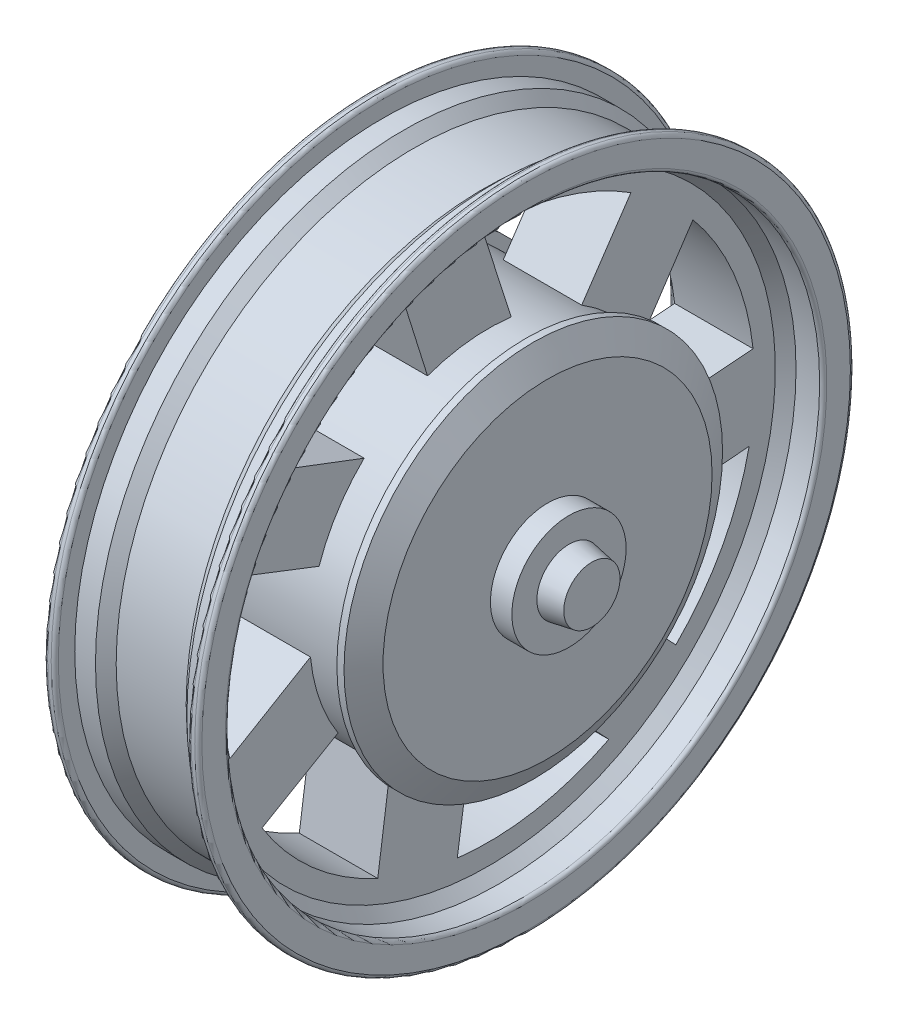
from build123d import *
from build123d.topology import SkipClean

# Parameters (mm, degrees)
SKETCH5_R           = 125
BOSS_EXTRUDE2_DEPTH = 26.543776145
BOSS_EXTRUDE3_START = 26.543776145
SKETCH6_R           = 125
BOSS_EXTRUDE3_DEPTH = 26.543776145
CUT_EXTRUDE1_DEPTH  = 335.627578667
SKETCH8_R           = 132.5
BOSS_EXTRUDE4_DEPTH = 15
BOSS_EXTRUDE5_START = 15
SKETCH9_R           = 132.5
BOSS_EXTRUDE5_DEPTH = 15
CHAMFER1_SIZE       = 10
CHAMFER1_SIZE2      = 17.320508076
CHAMFER2_SIZE       = 10
CHAMFER2_SIZE2      = 17.320508076
SKETCH10_R          = 40
BOSS_EXTRUDE6_DEPTH = 15
SKETCH11_R          = 50
BOSS_EXTRUDE7_DEPTH = 20
SKETCH12_R          = 22.5
BOSS_EXTRUDE8_DEPTH = 16
CHAMFER3_SIZE2      = 2.821231691
CHAMFER3_SIZE       = 16
FILLET1_R           = 2.5


with BuildPart() as part:
    # Sketch4 → Revolve1 (revolve)
    with BuildSketch(Plane.XY, mode=Mode.PRIVATE) as revolve1_sk:
        Polygon((27.456223855, 201), (34.956223855, 208), (54, 208), (54, 229.5), (46.5, 229.5), (46.5, 215.5), (32, 215.5), (24.5, 208.5), (-24.5, 208.5), (-32, 215.5), (-46.5, 215.5), (-46.5, 229.5), (-54, 229.5), (-54, 208), (-34.956223855, 208), (-27.456223855, 201), (-27.456223855, 0), (27.456223855, 0), align=None)
    revolve(revolve1_sk.sketch.rotate(Axis((-130.289806515, 0, 0), (1, 0, 0)), 90), axis=Axis((-130.289806515, 0, 0), (1, 0, 0)))

    # Sketch5 → Boss-Extrude2 (add)
    with BuildSketch(Plane(origin=(27.456223855, 0, 0), x_dir=(0, 0, -1), z_dir=(1, 0, 0))):
        with Locations(Location((0, 0, 0), (0, 0, 180))):
            Circle(SKETCH5_R)
    extrude(amount=BOSS_EXTRUDE2_DEPTH)

    # Sketch6 → Boss-Extrude3 (add)
    with BuildSketch(Plane.ZY.offset(27.456223855).offset(BOSS_EXTRUDE3_START)):
        Circle(SKETCH6_R)
    extrude(amount=-BOSS_EXTRUDE3_DEPTH)

    # Sketch7 → Cut-Extrude1 (cut, through all)
    with SkipClean():  # the faces are left unmerged after this step: merging them gives an invalid solid
        with BuildSketch(Plane.ZY.offset(27.456223855)):
            with BuildLine():
                Line((42.471778538, 117.56337877), (60.846979295, 176.294909486))
                ThreePointArc((60.846979295, 176.294909486), (109.205330342, 151.183483969), (148.241597448, 113.166597484))
                Line((148.241597448, 113.166597484), (86.877762106, 89.873547006))
                ThreePointArc((86.877762106, 89.873547006), (66.140060569, 106.068338292), (42.471778538, 117.56337877))
            make_face()
            with BuildLine():
                Line((118.395471493, 40.093794157), (175.770381499, 62.345994158))
                ThreePointArc((175.770381499, 62.345994158), (186.288417173, 8.881195149), (180.904332897, -45.341728453))
                Line((180.904332897, -45.341728453), (124.433367172, -11.888529526))
                ThreePointArc((124.433367172, -11.888529526), (124.165219428, 14.42214562), (118.395471493, 40.093794157))
            make_face()
            with BuildLine():
                Line((105.164959586, -67.56723522), (158.335101372, -98.550726397))
                ThreePointArc((158.335101372, -98.550726397), (123.092526281, -140.108814761), (77.342415899, -169.706808063))
                Line((77.342415899, -169.706808063), (68.288108779, -104.698300843))
                ThreePointArc((68.288108779, -104.698300843), (88.69143555, -88.084216862), (105.164959586, -67.56723522))
            make_face()
            with BuildLine():
                Line((12.743088136, -124.348758356), (21.670260464, -185.236739907))
                ThreePointArc((21.670260464, -185.236739907), (-32.79454753, -183.594029457), (-84.459917769, -166.279199813))
                Line((-84.459917769, -166.279199813), (-39.279488348, -118.668116169))
                ThreePointArc((-39.279488348, -118.668116169), (-13.568808273, -124.261367456), (12.743088136, -124.348758356))
            make_face()
            with BuildLine():
                Line((-89.274588592, -87.493130198), (-131.312728566, -132.435710126))
                ThreePointArc((-131.312728566, -132.435710126), (-163.986658164, -88.829195336), (-182.662210688, -37.639962627))
                Line((-182.662210688, -37.639962627), (-117.268829593, -43.278419632))
                ThreePointArc((-117.268829593, -43.278419632), (-105.611462713, -66.867173886), (-89.274588592, -87.493130198))
            make_face()
            with BuildLine():
                Line((-124.06667924, 15.246609534), (-185.414554695, 20.092110576))
                ThreePointArc((-185.414554695, 20.092110576), (-171.693470483, 72.825834658), (-143.316133329, 119.342934133))
                Line((-143.316133329, 119.342934133), (-106.952350307, 64.700809607))
                ThreePointArc((-106.952350307, 64.700809607), (-118.126531649, 40.879365462), (-124.06667924, 15.246609534))
            make_face()
            with BuildLine():
                Line((-65.434029922, 106.505341313), (-99.895439371, 157.49016221))
                ThreePointArc((-99.895439371, 157.49016221), (-50.111597619, 179.641525779), (3.949915543, 186.458167338))
                Line((3.949915543, 186.458167338), (-16.098569809, 123.959009556))
                ThreePointArc((-16.098569809, 123.959009556), (-41.689912911, 117.84290883), (-65.434029922, 106.505341313))
            make_face()
        extrude(amount=-CUT_EXTRUDE1_DEPTH, mode=Mode.SUBTRACT)
    add(part.part.scale(1), mode=Mode.REPLACE)  # the faces are merged on a copy

    # Sketch8 → Boss-Extrude4 (add)
    with BuildSketch(Plane(origin=(54, 0, 0), x_dir=(0, 0, -1), z_dir=(1, 0, 0))):
        Circle(SKETCH8_R)
    extrude(amount=BOSS_EXTRUDE4_DEPTH)

    # Sketch9 → Boss-Extrude5 (add)
    with BuildSketch(Plane.ZY.offset(54).offset(BOSS_EXTRUDE5_START)):
        with Locations(Location((0, 0, 0), (0, 0, 180))):
            Circle(SKETCH9_R)
    extrude(amount=-BOSS_EXTRUDE5_DEPTH)

    # Chamfer1
    chamfer1_edges = [part.edges().sort_by_distance(p)[0] for p in [
        (69, 0, 132.5),
    ]]
    chamfer1_side = [part.faces().sort_by_distance(p)[0] for p in [
        (61.5, 0, 132.5),
    ]]
    chamfer(chamfer1_edges, length=CHAMFER1_SIZE, length2=CHAMFER1_SIZE2, reference=chamfer1_side[0])

    # Chamfer2
    chamfer2_edges = [part.edges().sort_by_distance(p)[0] for p in [
        (-69, 0, 132.5),
    ]]
    chamfer2_side = [part.faces().sort_by_distance(p)[0] for p in [
        (-61.5, 0, 132.5),
    ]]
    chamfer(chamfer2_edges, length=CHAMFER2_SIZE, length2=CHAMFER2_SIZE2, reference=chamfer2_side[0])

    # Sketch10 → Boss-Extrude6 (add)
    with BuildSketch(Plane(origin=(69, 0, 0), x_dir=(0, 0, -1), z_dir=(1, 0, 0))):
        Circle(SKETCH10_R)
    extrude(amount=BOSS_EXTRUDE6_DEPTH)

    # Sketch11 → Boss-Extrude7 (add)
    with BuildSketch(Plane.ZY.offset(69)):
        Circle(SKETCH11_R)
    extrude(amount=BOSS_EXTRUDE7_DEPTH)

    # Sketch12 → Boss-Extrude8 (add)
    with BuildSketch(Plane(origin=(84, 0, 0), x_dir=(0, 0, -1), z_dir=(1, 0, 0))):
        Circle(SKETCH12_R)
    extrude(amount=BOSS_EXTRUDE8_DEPTH)

    # Chamfer3
    chamfer3_edges = [part.edges().sort_by_distance(p)[0] for p in [
        (100, 0, 22.5),
    ]]
    chamfer3_side = [part.faces().sort_by_distance(p)[0] for p in [
        (99.943575366, 0, 22.5),
    ]]
    chamfer(chamfer3_edges, length=CHAMFER3_SIZE - 0.0001, length2=CHAMFER3_SIZE2 - 0.0001, reference=chamfer3_side[0])  # a hair under: the kernel refuses the full size

    # Fillet1
    fillet1_edges = [part.edges().sort_by_distance(p)[0] for p in [
        (-46.5, 0, -229.5),
        (-54, 0, -229.5),
        (-54, 0, -208),
        (54, 0, -208),
        (54, 0, -229.5),
        (46.5, 0, -229.5),
    ]]
    fillet(fillet1_edges, radius=FILLET1_R)


solid = part.part
